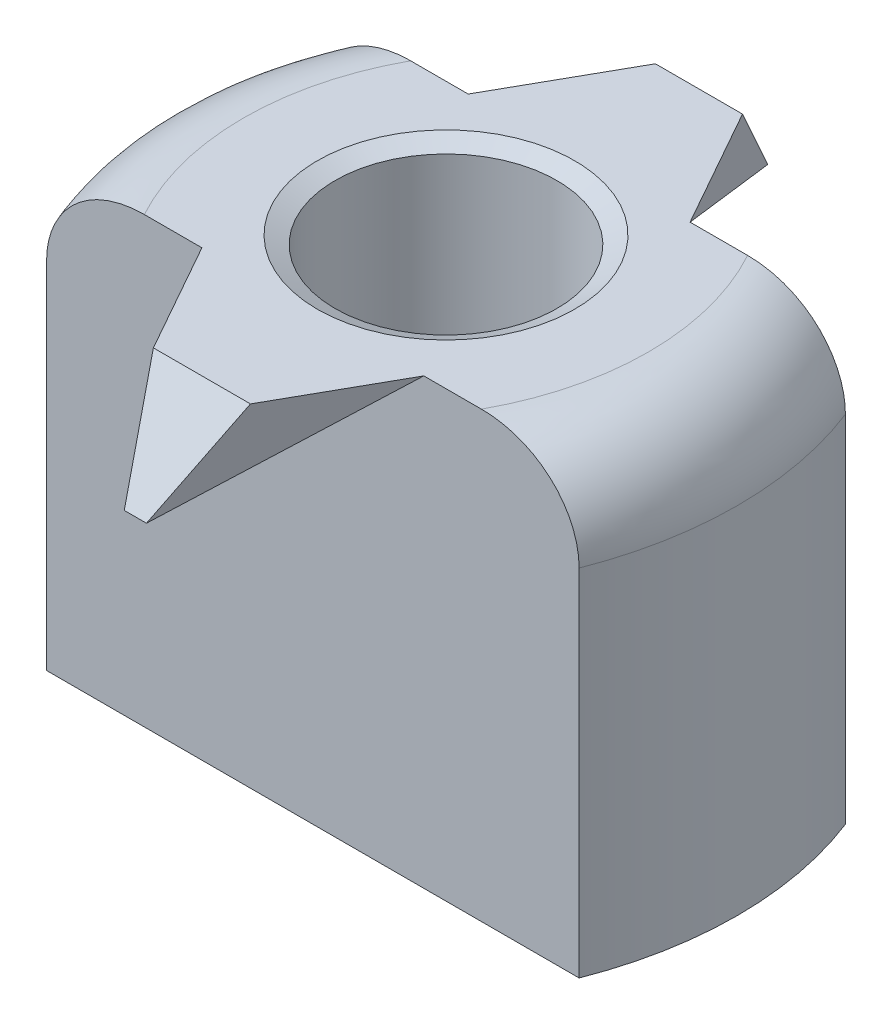
from build123d import *

# Parameters (mm, degrees)
SALIENTE_EXTRUIR1_DEPTH   = 10
CROQUIS2_R                = 2.5
CORTAR_EXTRUIR1_DEPTH     = 10
CHAFL_N1_SIZE             = 0.4
CHAFL_N1_SIZE2            = 0.186523063
SALIENTE_EXTRUIR2_DEPTH   = 2
CORTAR_EXTRUIR2_START     = 0.687515582
CORTAR_EXTRUIR2_OUTLINE_W = 5
CORTAR_EXTRUIR2_OUTLINE_H = 5
CORTAR_EXTRUIR2_DEPTH     = 2.312484418
CORTAR_EXTRUIR4_DEPTH     = 9.799366623
CORTAR_EXTRUIR5_DEPTH     = 4
CORTAR_EXTRUIR6_START     = 19.504007809
CORTAR_EXTRUIR6_OUTLINE_W = 5
CORTAR_EXTRUIR6_OUTLINE_H = 5
CORTAR_EXTRUIR6_DEPTH     = 1.2
REDONDEO1_R               = 2


with BuildPart() as part:
    # Croquis1 → Saliente-Extruir1 (new body)
    with BuildSketch(Plane(origin=(0, 0, 0), x_dir=(1, 0, 0), z_dir=(0, 1, 0))):
        with BuildLine():
            Line((4.858013613, -14.380009761), (4.858013613, -8.380009761))
            Line((4.858013613, -8.380009761), (-1.141986387, -8.380009761))
            ThreePointArc((-1.141986387, -8.380009761), (-1.707193124, -11.380009761), (-1.141986387, -14.380009761))
            Line((-1.141986387, -14.380009761), (4.858013613, -14.380009761))
        make_face()
        with BuildLine():
            Line((10.858013613, -8.380009761), (4.858013613, -8.380009761))
            Line((4.858013613, -8.380009761), (4.858013613, -14.380009761))
            Line((4.858013613, -14.380009761), (10.858013613, -14.380009761))
            ThreePointArc((10.858013613, -14.380009761), (11.423220351, -11.380009761), (10.858013613, -8.380009761))
        make_face()
    extrude(amount=SALIENTE_EXTRUIR1_DEPTH)

    # Croquis2 → Cortar-Extruir1 (cut)
    with BuildSketch(Plane(origin=(0, 10, 0), x_dir=(1, 0, 0), z_dir=(0, 1, 0))):
        with Locations(Location((4.858013613, -11.380009761, 0), (0, 0, 270))):
            Circle(CROQUIS2_R)
    extrude(amount=-CORTAR_EXTRUIR1_DEPTH, mode=Mode.SUBTRACT)

    # Chaflán1
    chafl_n1_edges = [part.edges().sort_by_distance(p)[0] for p in [
        (4.858013613, 10, 8.880009761),
    ]]
    chafl_n1_side = [part.faces().sort_by_distance(p)[0] for p in [
        (4.858013613, 10, 8.524373107),
    ]]
    chamfer(chafl_n1_edges, length=CHAFL_N1_SIZE, length2=CHAFL_N1_SIZE2, reference=chafl_n1_side[0])

    # Croquis3 → Saliente-Extruir2 (add)
    with BuildSketch(Plane(origin=(0, 10, 0), x_dir=(1, 0, 0), z_dir=(0, 1, 0))):
        Polygon((2.358013613, -8.380009761), (4.858013613, -8.380009761), (4.858013613, -4.380009761), (4.608013613, -4.380009761), align=None)
        Polygon((4.858013613, -4.380009761), (4.858013613, -8.380009761), (7.358013613, -8.380009761), (5.108013613, -4.380009761), align=None)
    saliente_extruir2 = extrude(amount=-SALIENTE_EXTRUIR2_DEPTH)

    # Cortar-Extruir2: read off the stored shape, not the designer's step
    # Cortar-Extruir2 outline → Cortar-Extruir2 (cut)
    with BuildSketch(Plane(origin=(0, 0, 0), x_dir=(1, 0, 0), z_dir=(0, 0.5449883505954141, -0.8384436163006372)).offset(CORTAR_EXTRUIR2_START)):
        with Locations((4.5, -10.5)):
            Rectangle(CORTAR_EXTRUIR2_OUTLINE_W, CORTAR_EXTRUIR2_OUTLINE_H)
    extrude(amount=CORTAR_EXTRUIR2_DEPTH, mode=Mode.SUBTRACT)

    # Cortar-Extruir4: read off the stored shape, not the designer's step
    # Cortar-Extruir4 outline → Cortar-Extruir4 (cut)
    with BuildSketch(Plane(origin=(-1.717842267, 1.932572551, 0), x_dir=(-0.7474093186836599, -0.6643638388299198, 0), z_dir=(0.6643638388299198, -0.7474093186836599, 0))):
        Polygon((-9.132687685, -4.380009761), (-12.14308633, -8.380009761), (-9.132687685, -8.380009761), align=None)
    cortar_extruir4 = extrude(amount=CORTAR_EXTRUIR4_DEPTH, mode=Mode.SUBTRACT)

    # Croquis13 → Cortar-Extruir5 (cut, along a direction that is not the sketch's normal)
    with BuildSketch(Plane(origin=(6.006295664, 6.757082622, 0), x_dir=(0.7474093186836596, -0.66436383882992, 0), z_dir=(0.66436383882992, 0.7474093186836596, 0))):
        Polygon((-1.870838395, -8.380009761), (-1.870838395, -4.380009761), (-4.88123704, -8.380009761), align=None)
    cortar_extruir5 = extrude(amount=-CORTAR_EXTRUIR5_DEPTH, dir=(0, 1, 0), mode=Mode.SUBTRACT)

    # Simetría1: Saliente-Extruir2 across plane
    add(saliente_extruir2.mirror(Plane(origin=(0, 0, 11.380009761), x_dir=(1, 0, 0), z_dir=(0, 0, -1))))

    # Simetría3: Cortar-Extruir4, Cortar-Extruir5 across plane
    add(cortar_extruir4.mirror(Plane(origin=(0, 0, 11.380009761), x_dir=(1, 0, 0), z_dir=(0, 0, -1))), mode=Mode.SUBTRACT)
    add(cortar_extruir5.mirror(Plane(origin=(0, 0, 11.380009761), x_dir=(1, 0, 0), z_dir=(0, 0, -1))), mode=Mode.SUBTRACT)

    # Cortar-Extruir6: read off the stored shape, not the designer's step
    # Cortar-Extruir6 outline → Cortar-Extruir6 (cut)
    with BuildSketch(Plane(origin=(0, 0, 0), x_dir=(1, 0, 0), z_dir=(0, 0.5999999999999971, 0.8000000000000023)).offset(CORTAR_EXTRUIR6_START)):
        with Locations((4.5, -3.5)):
            Rectangle(CORTAR_EXTRUIR6_OUTLINE_W, CORTAR_EXTRUIR6_OUTLINE_H)
    extrude(amount=CORTAR_EXTRUIR6_DEPTH, mode=Mode.SUBTRACT)

    # Redondeo1
    redondeo1_edges = [part.edges().sort_by_distance(p)[0] for p in [
        (-1.707193124, 10, 11.380009761),
        (11.423220351, 10, 11.380009761),
    ]]
    fillet(redondeo1_edges, radius=REDONDEO1_R)


solid = part.part
